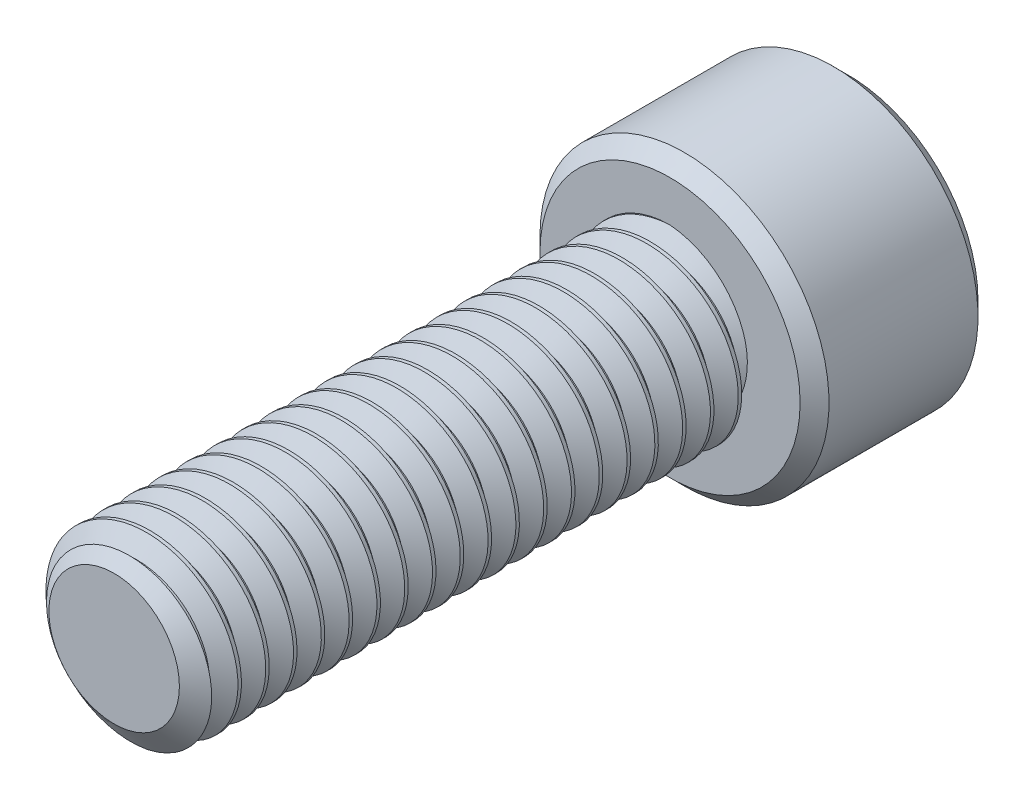
from build123d import *

# Parameters (mm, degrees)
SKETCH1_R          = 4
EXTRUDE1_DEPTH     = 25
CUT_SWEEP1_PITCH   = 1.25
SKETCH6_R          = 6.5
EXTRUDE2_DEPTH     = 8
CUT_EXTRUDE1_DEPTH = 4.5
CHAMFER1_SIZE      = 0.65


with BuildPart() as part:
    # Sketch1 → Extrude1 (new body)
    with BuildSketch(Plane.XY):
        Circle(SKETCH1_R)
    extrude(amount=-EXTRUDE1_DEPTH)

    # Cut-Sweep1: the profile of Sketch3 profile screwed along a right-hand helix of 21 turns, 6 arcs to a turn; built about Z, then put on its axis
    cut_sweep1_z = Axis((0, 0, 0), (0, 0, 1))
    cut_sweep1_corners = [(4.0003, 0, -1.093923205), (3.188101184, 0, -0.625), (3.188101184, 0, -0.46875), (4.0003, 0, 0.000173205)]
    with BuildLine(mode=Mode.PRIVATE) as cut_sweep1_profile:
        Line(cut_sweep1_corners[0], cut_sweep1_corners[1])
        Line(cut_sweep1_corners[1], cut_sweep1_corners[2])
        Line(cut_sweep1_corners[2], cut_sweep1_corners[3])
        Line(cut_sweep1_corners[3], cut_sweep1_corners[0])
    cut_sweep1_cap = Face(cut_sweep1_profile.wire())
    cut_sweep1_turn_angles = [0, 30, 60, 90, 120, 150, 180, 210, 240, 270, 300, 330, 360]
    cut_sweep1_turn_weights = [1, 0.8660254037844387, 1, 0.8660254037844387, 1, 0.8660254037844387, 1, 0.8660254037844387, 1, 0.8660254037844387, 1, 0.8660254037844387, 1]
    cut_sweep1_turn_rails = [Edge.make_bspline([Vector(p[0], p[1], 0).rotate(cut_sweep1_z, cut_sweep1_turn_angles[k]) / cut_sweep1_turn_weights[k] + Vector(0, 0, p[2] + CUT_SWEEP1_PITCH * cut_sweep1_turn_angles[k] / 360) for k in range(13)], [0, 0, 0, 1, 1, 2, 2, 3, 3, 4, 4, 5, 5, 6, 6, 6], 2, cut_sweep1_turn_weights) for p in cut_sweep1_corners]
    cut_sweep1_turn_sides = [Face.make_surface_from_curves(cut_sweep1_turn_rails[p[0]], cut_sweep1_turn_rails[p[1]]) for p in [(0, 1), (1, 2), (2, 3), (3, 0)]]
    cut_sweep1 = Plane(origin=(0, 0, 0), x_dir=(0, 1, 0), z_dir=(0, 0, -1)) * Solid(Shell([*[p.moved(Location((0, 0, CUT_SWEEP1_PITCH * i))) for i in range(21) for p in cut_sweep1_turn_sides], cut_sweep1_cap, cut_sweep1_cap.rotate(cut_sweep1_z, 7560).moved(Location((0, 0, CUT_SWEEP1_PITCH * 7560 / 360)))]))
    add(cut_sweep1, mode=Mode.SUBTRACT)

    # Sketch4 → Cut-Revolve1 (revolve, cut)
    with BuildSketch(Plane(origin=(0, 0, 0), x_dir=(0, 0, -1), z_dir=(1, 0, 0)), mode=Mode.PRIVATE) as cut_revolve1_sk:
        Polygon((0.746350386, 4), (0, 2.934101184), (0, 4), align=None)
    revolve(cut_revolve1_sk.sketch.rotate(Axis((0, 0, 0), (0, 0, -1)), 270), axis=Axis((0, 0, 0), (0, 0, -1)), mode=Mode.SUBTRACT)

    # Sketch6 → Extrude2 (add)
    with BuildSketch(Plane(origin=(0, 0, -25), x_dir=(-1, 0, 0), z_dir=(0, 0, -1))):
        Circle(SKETCH6_R)
    extrude(amount=EXTRUDE2_DEPTH)

    # Sketch7 → Cut-Extrude1 (cut)
    with BuildSketch(Plane(origin=(0, 0, -33), x_dir=(-1, 0, 0), z_dir=(0, 0, -1))):
        Polygon((0, 3.464101615), (-3, 1.732050808), (-3, -1.732050808), (0, -3.464101615), (3, -1.732050808), (3, 1.732050808), align=None)
    extrude(amount=-CUT_EXTRUDE1_DEPTH, mode=Mode.SUBTRACT)

    # Cut-Extrude2 cone 1 section (through the dimple's axis) → Cut-Extrude2 (revolve, cut)
    with BuildSketch(Plane(origin=(0, 0, -33), x_dir=(0, 1, 0), z_dir=(1, 0, 0))):
        Polygon((0, 0), (3.464101615, 0), (0, 3.464101615), align=None)
    revolve(axis=Axis((0, 0, -33), (0, 0, 1)), mode=Mode.SUBTRACT)

    # Chamfer1
    chamfer1_edges = [part.edges().sort_by_distance(p)[0] for p in [
        (6.5, 0, -25),
        (6.5, 0, -33),
    ]]
    chamfer(chamfer1_edges, length=CHAMFER1_SIZE)


solid = part.part
